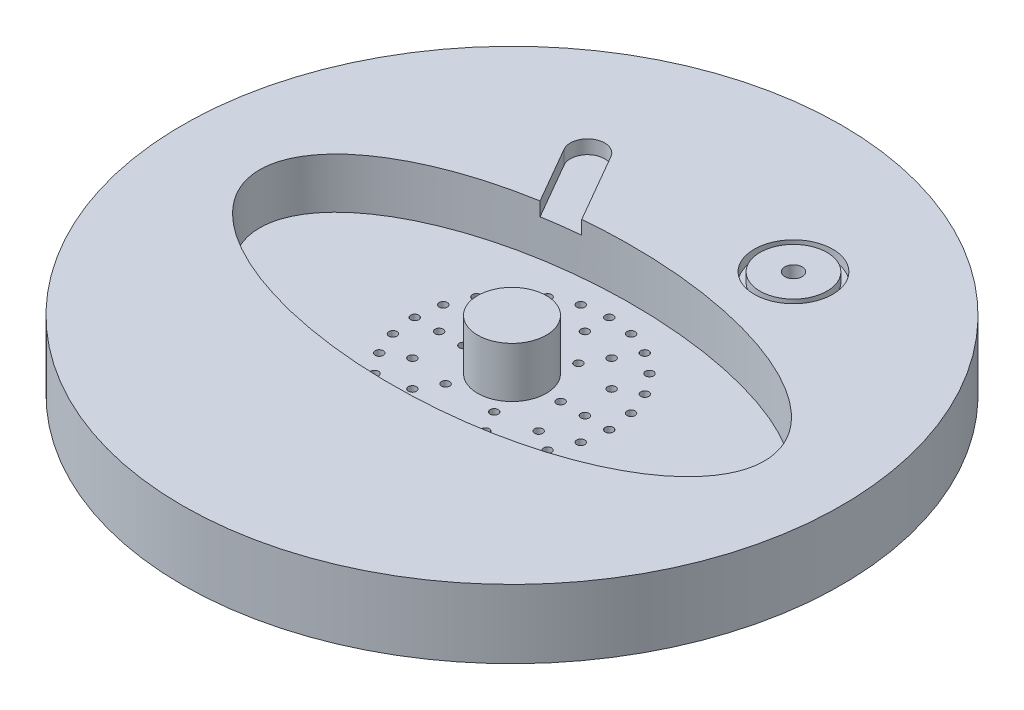
from build123d import *

# Parameters (mm, degrees)
SKETCH1_R                       = 60.96
BILLET_DEPTH                    = 12.7
SKETCH4_R                       = 0.7493
FIRST_KEROSENE_OUTLET_DEPTH     = 88.140881336
PRIMARY_HOLES_COUNT             = 6
SECOND_START                    = -12.7
SECOND_RING_OUTLINE_R           = 0.7493
SECOND_RING_DEPTH               = 12.7
THIRD_START                     = -12.7
THIRD_RING_OUTLINE_R            = 0.7493
THIRD_RING_DEPTH                = 12.7
SKETCH18_RX                     = 46.67504
SKETCH18_RY                     = 22.225
KEROSENE_WELL_DEPTH             = 9.3218
SKETCH17_R                      = 6.35
BOSS_EXTRUDE1_DEPTH             = 2.54
BOSS_EXTRUDE1_DIRECTION_2_REACH = 89.141
SKETCH21_R                      = 6.35
CUT_EXTRUDE1_DEPTH              = 2.54
CUT_EXTRUDE2_DEPTH              = 2.54
SKETCH15_R                      = 59.69
SKETCH15_R_2                    = 57.15
CUT_EXTRUDE3_DEPTH              = 1.778
F_1_8_0_125_DIAMETER_HOLE2_D    = 3.175
SKETCH31_R                      = 7.24947448
SKETCH31_R_2                    = 6.200396603
CUT_EXTRUDE4_DEPTH              = 1.778


# Read off the part's stored shape, not the designer's step: Second ring, Third Ring
with BuildPart() as part:
    # Sketch1 → Billet (new body)
    with BuildSketch(Plane(origin=(0, 0, 0), x_dir=(1, 0, 0), z_dir=(0, 1, 0))):
        with Locations(Location((0, 0, 0), (0, 0, 270))):
            Circle(SKETCH1_R)
    extrude(amount=-BILLET_DEPTH)

    # Sketch4 → First Kerosene Outlet (cut, symmetric)
    with BuildSketch(Plane(origin=(0, -12.7, 0), x_dir=(1, 0, 0), z_dir=(0, 1, 0))):
        with Locations(Location((8.9916, 0, 0), (0, 0, 270))):
            Circle(SKETCH4_R)
        with Locations(Location((13.4874, 0, 0), (0, 0, 270))):
            Circle(SKETCH4_R)
        with Locations(Location((17.9832, 0, 0), (0, 0, 270))):
            Circle(SKETCH4_R)
    first_kerosene_outlet = extrude(amount=FIRST_KEROSENE_OUTLET_DEPTH, both=True, mode=Mode.SUBTRACT)

    # Primary Holes: First Kerosene Outlet ×6 about axis
    primary_holes_axis = Axis((0, 0, 0), (0, 1, 0))
    for i in range(1, PRIMARY_HOLES_COUNT):
        add(first_kerosene_outlet.rotate(primary_holes_axis, i * 360 / PRIMARY_HOLES_COUNT), mode=Mode.SUBTRACT)

    # Second ring outline → Second ring (cut)
    with BuildSketch(Plane(origin=(0, 0, 0), x_dir=(1, 0, 0), z_dir=(0, 1, 0)).offset(SECOND_START)):
        with Locations((11.680431031, 6.7437)):
            Circle(SECOND_RING_OUTLINE_R)
        with Locations((0, 13.4874)):
            Circle(SECOND_RING_OUTLINE_R)
        with Locations((-11.680431031, 6.7437)):
            Circle(SECOND_RING_OUTLINE_R)
        with Locations((-11.680431031, -6.7437)):
            Circle(SECOND_RING_OUTLINE_R)
        with Locations((0, -13.4874)):
            Circle(SECOND_RING_OUTLINE_R)
        with Locations((11.680431031, -6.7437)):
            Circle(SECOND_RING_OUTLINE_R)
    extrude(amount=SECOND_RING_DEPTH, mode=Mode.SUBTRACT)

    # Third Ring outline → Third Ring (cut)
    with BuildSketch(Plane(origin=(0, 0, 0), x_dir=(1, 0, 0), z_dir=(0, 1, 0)).offset(THIRD_START)):
        with Locations((17.370437319, 4.654394652)):
            Circle(THIRD_RING_OUTLINE_R)
        with Locations((15.573908041, 8.9916)):
            Circle(THIRD_RING_OUTLINE_R)
        with Locations((12.716042667, 12.716042667)):
            Circle(THIRD_RING_OUTLINE_R)
        with Locations((4.654394652, 17.370437319)):
            Circle(THIRD_RING_OUTLINE_R)
        with Locations((0, 17.9832)):
            Circle(THIRD_RING_OUTLINE_R)
        with Locations((-4.654394652, 17.370437319)):
            Circle(THIRD_RING_OUTLINE_R)
        with Locations((-12.716042667, 12.716042667)):
            Circle(THIRD_RING_OUTLINE_R)
        with Locations((-15.573908041, 8.9916)):
            Circle(THIRD_RING_OUTLINE_R)
        with Locations((-17.370437319, 4.654394652)):
            Circle(THIRD_RING_OUTLINE_R)
        with Locations((-17.370437319, -4.654394652)):
            Circle(THIRD_RING_OUTLINE_R)
        with Locations((-15.573908041, -8.9916)):
            Circle(THIRD_RING_OUTLINE_R)
        with Locations((-12.716042667, -12.716042667)):
            Circle(THIRD_RING_OUTLINE_R)
        with Locations((-4.654394652, -17.370437319)):
            Circle(THIRD_RING_OUTLINE_R)
        with Locations((0, -17.9832)):
            Circle(THIRD_RING_OUTLINE_R)
        with Locations((4.654394652, -17.370437319)):
            Circle(THIRD_RING_OUTLINE_R)
        with Locations((12.716042667, -12.716042667)):
            Circle(THIRD_RING_OUTLINE_R)
        with Locations((15.573908041, -8.9916)):
            Circle(THIRD_RING_OUTLINE_R)
        with Locations((17.370437319, -4.654394652)):
            Circle(THIRD_RING_OUTLINE_R)
    extrude(amount=THIRD_RING_DEPTH, mode=Mode.SUBTRACT)

    # Sketch18 → Kerosene Well (cut)
    with BuildSketch(Plane(origin=(0, 0, 0), x_dir=(1, 0, 0), z_dir=(0, 1, 0))):
        with Locations(Location((0, 0), (0, 0, -180))):
            Ellipse(SKETCH18_RX, SKETCH18_RY)
    extrude(amount=-KEROSENE_WELL_DEPTH, mode=Mode.SUBTRACT)

    # Sketch17 → Boss-Extrude1 (add)
    with BuildSketch(Plane(origin=(0, 0, 0), x_dir=(1, 0, 0), z_dir=(0, 1, 0))):
        with Locations(Location((0, 0, 0), (0, 0, 270))):
            Circle(SKETCH17_R)
    extrude(amount=BOSS_EXTRUDE1_DEPTH)

    # Sketch17 → Boss-Extrude1 direction 2 (add, up to next)
    with BuildSketch(Plane(origin=(0, 0, 0), x_dir=(1, 0, 0), z_dir=(0, 1, 0)), mode=Mode.PRIVATE) as boss_extrude1_direction_2_sk1:
        with Locations(Location((0, 0, 0), (0, 0, 270))):
            Circle(SKETCH17_R)
    boss_extrude1_direction_2_tool1 = extrude(boss_extrude1_direction_2_sk1.sketch, amount=-BOSS_EXTRUDE1_DIRECTION_2_REACH, mode=Mode.PRIVATE) - part.part
    add(boss_extrude1_direction_2_tool1.solids().sort_by_distance((0, 0, 0))[0])

    # Sketch21 → Cut-Extrude1 (cut)
    with BuildSketch(Plane(origin=(0, 2.54, 0), x_dir=(1, 0, 0), z_dir=(0, 1, 0))):
        with Locations(Location((0, 0, 0), (0, 0, 270))):
            Circle(SKETCH21_R)
    extrude(amount=-CUT_EXTRUDE1_DEPTH, mode=Mode.SUBTRACT)

    # Sketch24 → Cut-Extrude2 (cut)
    with BuildSketch(Plane(origin=(0, 0, 0), x_dir=(1, 0, 0), z_dir=(0, 1, 0))):
        with BuildLine():
            Line((-15.732765962, 20.924382105), (-21.799630657, 31.4325))
            ThreePointArc((-21.799630657, 31.4325), (-20.6375, 35.769630657), (-16.300369343, 34.6075))
            Line((-16.300369343, 34.6075), (-8.915091663, 21.81582383))
            add(Edge.make_bspline(
                [(-8.915091663, 21.81582383), (-12.395027666, 21.493390748), (-15.732765962, 20.924382105)],
                knots=[4.904573252, 4.904573252, 4.904573252, 5.056192247, 5.056192247, 5.056192247], degree=2, weights=[1, 0.997127836, 1]))
        make_face()
    extrude(amount=-CUT_EXTRUDE2_DEPTH, mode=Mode.SUBTRACT)

    # Sketch15 → Cut-Extrude3 (cut)
    with BuildSketch(Plane(origin=(0, -12.7, 0), x_dir=(1, 0, 0), z_dir=(0, 1, 0))):
        with Locations(Location((0, 0, 0), (0, 0, 270))):
            Circle(SKETCH15_R)
        with Locations(Location((0, 0, 0), (0, 0, 270))):
            Circle(SKETCH15_R_2, mode=Mode.SUBTRACT)
    extrude(amount=CUT_EXTRUDE3_DEPTH, mode=Mode.SUBTRACT)

    # 1/8 (0.125) Diameter Hole2 (through all)
    with Locations(Plane(origin=(19.05, 0, -33.02), x_dir=(0, 0, 1), z_dir=(0, 1, 0))):
        with Locations((0, 0)):
            Hole(F_1_8_0_125_DIAMETER_HOLE2_D / 2)

    # Sketch31 → Cut-Extrude4 (cut)
    with BuildSketch(Plane(origin=(0, 0, 0), x_dir=(1, 0, 0), z_dir=(0, 1, 0))):
        with Locations(Location((19.05, 33.02, 0), (0, 0, 270))):
            Circle(SKETCH31_R)
        with Locations(Location((19.05, 33.02, 0), (0, 0, 270))):
            Circle(SKETCH31_R_2, mode=Mode.SUBTRACT)
    extrude(amount=-CUT_EXTRUDE4_DEPTH, mode=Mode.SUBTRACT)


solid = part.part
